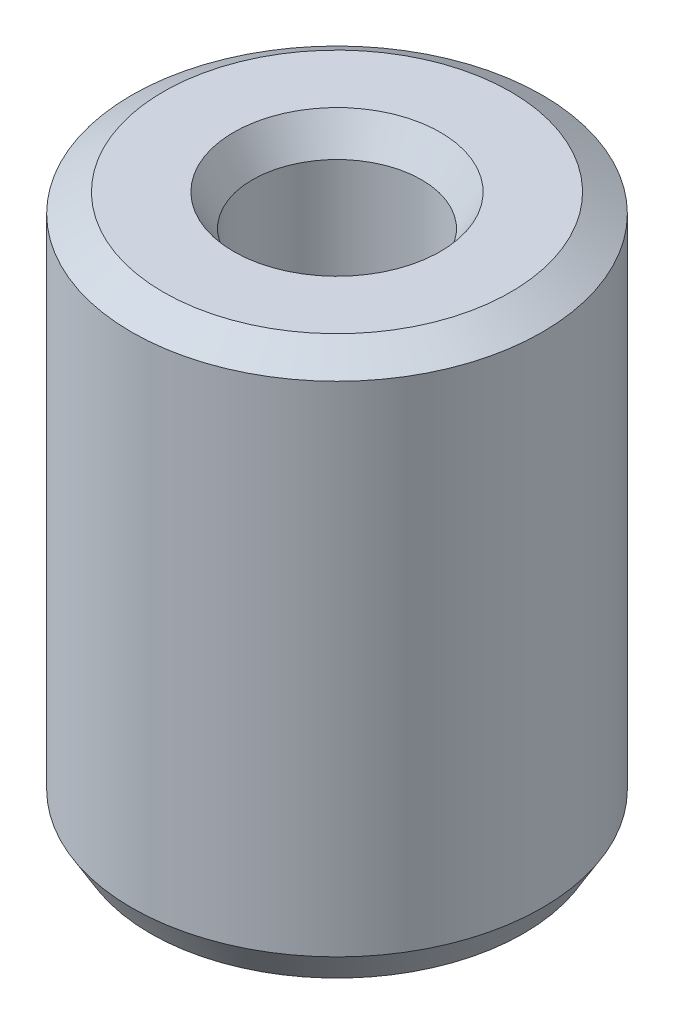
from build123d import *
from OCP.BRepFilletAPI import BRepFilletAPI_MakeChamfer

# Parameters (mm, degrees)
SKETCH1_R           = 7.5
BOSS_EXTRUDE1_DEPTH = 20.053420662
SKETCH2_R           = 3.08728502
CUT_EXTRUDE1_DEPTH  = 23.685671254
CHAMFER1_SIZE       = 0.687558073
CHAMFER1_SIZE2      = 1.156869032


with BuildPart() as part:
    # Sketch1 → Boss-Extrude1 (new body)
    with BuildSketch(Plane(origin=(0, 0, 0), x_dir=(1, 0, 0), z_dir=(0, 1, 0))):
        Circle(SKETCH1_R)
    extrude(amount=BOSS_EXTRUDE1_DEPTH)

    # Sketch2 → Cut-Extrude1 (cut, through all)
    with BuildSketch(Plane(origin=(0, 0, 0), x_dir=(1, 0, 0), z_dir=(0, 1, 0))):
        Circle(SKETCH2_R)
    extrude(amount=CUT_EXTRUDE1_DEPTH, mode=Mode.SUBTRACT)

    # Chamfer1: one chamfer whose edges measure the first distance from different faces: ONE call of the kernel's chamfer builder (chamfer() names one face for all edges)
    chamfer1_edges_1 = [part.edges().sort_by_distance(p)[0] for p in [
        (-3.08728502, 20.053420662, 0),
    ]]
    chamfer1_side_1 = [part.faces().sort_by_distance(p)[0] for p in [
        (-7.287867966, 20.053420662, 0),
    ]]
    chamfer1_edges_2 = [part.edges().sort_by_distance(p)[0] for p in [
        (-3.08728502, 0, 0),
    ]]
    chamfer1_side_2 = [part.faces().sort_by_distance(p)[0] for p in [
        (-3.08728502, 10.026710331, 0),
    ]]
    chamfer1_edges_3 = [part.edges().sort_by_distance(p)[0] for p in [
        (-7.5, 0, 0),
    ]]
    chamfer1_side_3 = [part.faces().sort_by_distance(p)[0] for p in [
        (-7.287867966, 0, 0),
    ]]
    chamfer1_edges_4 = [part.edges().sort_by_distance(p)[0] for p in [
        (-7.5, 20.053420662, 0),
    ]]
    chamfer1_side_4 = [part.faces().sort_by_distance(p)[0] for p in [
        (-7.5, 10.026710331, 0),
    ]]
    chamfer1 = BRepFilletAPI_MakeChamfer(part.part.solid().wrapped)
    for e in chamfer1_edges_1:
        chamfer1.Add(CHAMFER1_SIZE, CHAMFER1_SIZE2, e.wrapped, chamfer1_side_1[0].wrapped)  # the first distance lies on this face
    for e in chamfer1_edges_2:
        chamfer1.Add(CHAMFER1_SIZE, CHAMFER1_SIZE2, e.wrapped, chamfer1_side_2[0].wrapped)  # the first distance lies on this face
    for e in chamfer1_edges_3:
        chamfer1.Add(CHAMFER1_SIZE, CHAMFER1_SIZE2, e.wrapped, chamfer1_side_3[0].wrapped)  # the first distance lies on this face
    for e in chamfer1_edges_4:
        chamfer1.Add(CHAMFER1_SIZE, CHAMFER1_SIZE2, e.wrapped, chamfer1_side_4[0].wrapped)  # the first distance lies on this face
    add(Compound.cast(chamfer1.Shape()), mode=Mode.REPLACE)


solid = part.part
